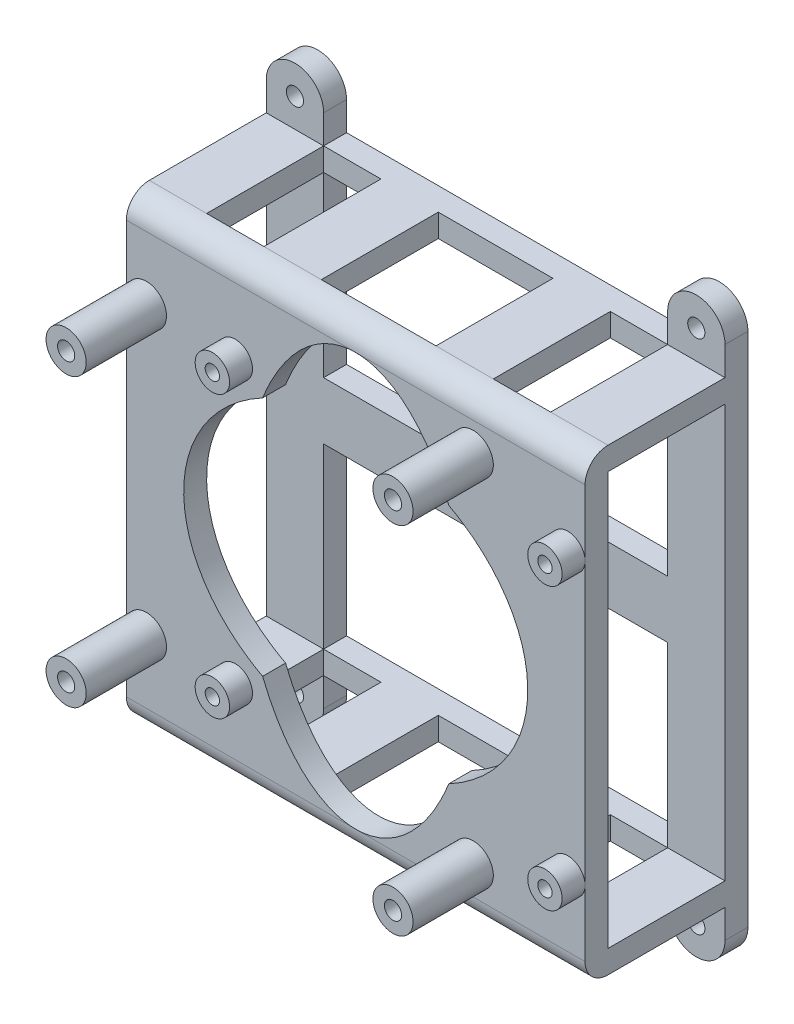
from build123d import *
from build123d.topology import SkipClean

# Parameters (mm, degrees)
CROQUIS1_W                 = 10
CROQUIS1_H                 = 10
CROQUIS1_R                 = 1.5
CROQUIS1_H_2               = 4
CROQUIS1_R_2               = 3
CROQUIS1_R_3               = 1.25
CROQUIS1_R_4               = 3.5
CROQUIS1_R_5               = 2.2
SALIENTE_EXTRUIR5_DEPTH    = 4
SALIENTE_EXTRUIR6_START    = 4
CROQUIS1_6_W               = 10
CROQUIS1_6_H               = 4
SALIENTE_EXTRUIR6_DEPTH    = 20.4
SALIENTE_EXTRUIR7_START    = 24.4
CROQUIS1_7_W               = 10
CROQUIS1_7_H               = 4
CROQUIS1_7_R               = 3
CROQUIS1_7_R_2             = 3.5
CROQUIS1_7_R_3             = 2.2
CROQUIS1_7_R_4             = 1.5
CROQUIS1_7_R_5             = 1.25
CROQUIS1_7_H_2             = 31
CROQUIS1_7_H_3             = 10
SALIENTE_EXTRUIR7_DEPTH    = 4
SALIENTE_EXTRUIR9_START    = 28.4
CROQUIS1_10_R              = 3
SALIENTE_EXTRUIR9_DEPTH    = 4
SALIENTE_EXTRUIR10_START   = 28.4
CROQUIS1_11_R              = 3.5
SALIENTE_EXTRUIR10_DEPTH   = 14
CORTAR_EXTRUIR1_DEPTH      = 14
CORTAR_EXTRUIR1_DEPTH_BACK = 14
CORTAR_EXTRUIR1_START      = 28.4
CROQUIS1_12_R              = 1.5
CROQUIS1_12_R_2            = 1.25
CORTAR_EXTRUIR2_START      = 24.4
CROQUIS1_13_R              = 2.2
CORTAR_EXTRUIR2_DEPTH      = 15
REDONDEO2_RADIUS           = 5
REDONDEO2_LENGTH           = 4
REDONDEO3_RADIUS           = 5
REDONDEO3_LENGTH           = 4
REDONDEO4_RADIUS           = 5
REDONDEO4_LENGTH           = 4
REDONDEO5_RADIUS           = 5
REDONDEO5_LENGTH           = 4
REDONDEO6_R                = 4
REDONDEO7_R                = 4
CORTAR_EXTRUIR6_START      = 28.4
CROQUIS2_RX                = 30
CROQUIS2_RY                = 25
CROQUIS2_RX_2              = 36
CROQUIS2_RY_2              = 20
CORTAR_EXTRUIR6_DEPTH      = 8


with BuildPart() as part:
    # Croquis1 → Saliente-Extruir5 (new body)
    # profile 1 of 42: a face of its own
    with SkipClean():  # the faces are left unmerged after this step: merging them gives an invalid solid
        with BuildSketch(Plane.XY):
            with Locations((-45.946521078, 63.070175439)):
                Rectangle(CROQUIS1_W, CROQUIS1_H)
            with Locations((-45.946521078, 63.070175439)):
                Circle(CROQUIS1_R, mode=Mode.SUBTRACT)
        # profile 2 of 42: a face of its own
        with BuildSketch(Plane.XY):
            with Locations((24.053478922, 63.070175439)):
                Rectangle(CROQUIS1_W, CROQUIS1_H)
            with Locations((24.053478922, 63.070175439)):
                Circle(CROQUIS1_R, mode=Mode.SUBTRACT)
        # profile 3 of 42: a face of its own
        with BuildSketch(Plane.XY):
            with Locations((24.053478922, -26.929824561)):
                Rectangle(CROQUIS1_W, CROQUIS1_H)
            with Locations((24.053478922, -26.929824561)):
                Circle(CROQUIS1_R, mode=Mode.SUBTRACT)
        # profile 4 of 42: a face of its own
        with BuildSketch(Plane.XY):
            with Locations((-45.946521078, -26.929824561)):
                Rectangle(CROQUIS1_W, CROQUIS1_H)
            with Locations((-45.946521078, -26.929824561)):
                Circle(CROQUIS1_R, mode=Mode.SUBTRACT)
        # profile 5 of 42: a face of its own
        with BuildSketch(Plane.XY):
            with Locations((-45.946521078, -19.929824561)):
                Rectangle(CROQUIS1_W, CROQUIS1_H_2)
        # profile 6 of 42: a face of its own
        with BuildSketch(Plane.XY):
            with Locations((-35.946521078, -19.929824561)):
                Rectangle(CROQUIS1_W, CROQUIS1_H_2)
        # profile 7 of 42: a face of its own
        with BuildSketch(Plane.XY):
            with Locations((-25.946521078, -19.929824561)):
                Rectangle(CROQUIS1_W, CROQUIS1_H_2)
        # profile 8 of 42: a face of its own
        with BuildSketch(Plane.XY):
            with Locations((-15.946521078, -19.929824561)):
                Rectangle(CROQUIS1_W, CROQUIS1_H_2)
        # profile 9 of 42: a face of its own
        with BuildSketch(Plane.XY):
            with Locations((-5.946521078, -19.929824561)):
                Rectangle(CROQUIS1_W, CROQUIS1_H_2)
        # profile 10 of 42: a face of its own
        with BuildSketch(Plane.XY):
            with Locations((4.053478922, -19.929824561)):
                Rectangle(CROQUIS1_W, CROQUIS1_H_2)
        # profile 11 of 42: a face of its own
        with BuildSketch(Plane.XY):
            with Locations((14.053478922, -19.929824561)):
                Rectangle(CROQUIS1_W, CROQUIS1_H_2)
        # profile 12 of 42: a face of its own
        with BuildSketch(Plane.XY):
            with Locations((24.053478922, -19.929824561)):
                Rectangle(CROQUIS1_W, CROQUIS1_H_2)
        # profile 13 of 42: a face of its own
        with BuildSketch(Plane.XY):
            Polygon((29.053478922, 13.070175439), (19.053478922, 13.070175439), (19.053478922, -17.929824561), (29.053478922, -17.929824561), (29.053478922, -6.429824561), align=None)
            with Locations((26.053478922, -6.429824561)):
                Circle(CROQUIS1_R_2, mode=Mode.SUBTRACT)
        # profile 14 of 42: a face of its own
        with BuildSketch(Plane.XY):
            with Locations((26.053478922, -6.429824561)):
                Circle(CROQUIS1_R_2)
            with Locations((26.053478922, -6.429824561)):
                Circle(CROQUIS1_R_3, mode=Mode.SUBTRACT)
        # profile 15 of 42: a face of its own
        with BuildSketch(Plane.XY):
            with Locations((26.053478922, -6.429824561)):
                Circle(CROQUIS1_R_3)
        # profile 16 of 42: a face of its own
        with BuildSketch(Plane.XY):
            Polygon((-40.946521078, -17.929824561), (-40.946521078, 13.070175439), (-50.946521078, 13.070175439), (-50.946521078, -6.929824541), (-50.946521078, -17.929824561), align=None)
            with BuildLine():
                ThreePointArc((-43.946521078, -6.929824561), (-47.446521088, -10.429824561), (-50.946521078, -6.929824541))
                ThreePointArc((-50.946521078, -6.929824541), (-47.446521067, -3.429824561), (-43.946521078, -6.929824561))
            make_face(mode=Mode.SUBTRACT)
        # profile 17 of 42: a face of its own
        with BuildSketch(Plane.XY):
            with Locations((-47.446521078, -6.929824561)):
                Circle(CROQUIS1_R_4)
            with Locations((-47.446521078, -6.929824561)):
                Circle(CROQUIS1_R_5, mode=Mode.SUBTRACT)
        # profile 18 of 42: a face of its own
        with BuildSketch(Plane.XY):
            with Locations((-47.446521078, -6.929824561)):
                Circle(CROQUIS1_R_5)
            with Locations((-47.446521078, -6.929824561)):
                Circle(CROQUIS1_R, mode=Mode.SUBTRACT)
        # profile 19 of 42: a face of its own
        with BuildSketch(Plane.XY):
            with Locations((-47.446521078, -6.929824561)):
                Circle(CROQUIS1_R)
        # profile 20 of 42: a face of its own
        with BuildSketch(Plane.XY):
            with Locations((-45.946521078, 18.070175439)):
                Rectangle(CROQUIS1_W, CROQUIS1_H)
        # profile 21 of 42: a face of its own
        with BuildSketch(Plane.XY):
            with Locations((-35.946521078, 18.070175439)):
                Rectangle(CROQUIS1_W, CROQUIS1_H)
        # profile 22 of 42: a face of its own
        with BuildSketch(Plane.XY):
            with Locations((-25.946521078, 18.070175439)):
                Rectangle(CROQUIS1_W, CROQUIS1_H)
        # profile 23 of 42: a face of its own
        with BuildSketch(Plane.XY):
            with Locations((-15.946521078, 18.070175439)):
                Rectangle(CROQUIS1_W, CROQUIS1_H)
        # profile 24 of 42: a face of its own
        with BuildSketch(Plane.XY):
            with Locations((-5.946521078, 18.070175439)):
                Rectangle(CROQUIS1_W, CROQUIS1_H)
        # profile 25 of 42: a face of its own
        with BuildSketch(Plane.XY):
            with Locations((4.053478922, 18.070175439)):
                Rectangle(CROQUIS1_W, CROQUIS1_H)
        # profile 26 of 42: a face of its own
        with BuildSketch(Plane.XY):
            with Locations((14.053478922, 18.070175439)):
                Rectangle(CROQUIS1_W, CROQUIS1_H)
        # profile 27 of 42: a face of its own
        with BuildSketch(Plane.XY):
            with Locations((24.053478922, 18.070175439)):
                Rectangle(CROQUIS1_W, CROQUIS1_H)
        # profile 28 of 42: a face of its own
        with BuildSketch(Plane.XY):
            Polygon((-40.946521078, 54.070175439), (-50.946521078, 54.070175439), (-50.946521078, 43.070175439), (-50.946521078, 23.070175439), (-40.946521078, 23.070175439), align=None)
            with BuildLine():
                ThreePointArc((-43.946521078, 43.070175439), (-47.446521078, 39.570175439), (-50.946521078, 43.070175439))
                ThreePointArc((-50.946521078, 43.070175439), (-47.446521078, 46.570175439), (-43.946521078, 43.070175439))
            make_face(mode=Mode.SUBTRACT)
        # profile 29 of 42: a face of its own
        with BuildSketch(Plane.XY):
            with Locations((-45.946521078, 56.070175439)):
                Rectangle(CROQUIS1_W, CROQUIS1_H_2)
        # profile 30 of 42: a face of its own
        with BuildSketch(Plane.XY):
            with Locations((-47.446521078, 43.070175439)):
                Circle(CROQUIS1_R_4)
            with Locations((-47.446521078, 43.070175439)):
                Circle(CROQUIS1_R_5, mode=Mode.SUBTRACT)
        # profile 31 of 42: a face of its own
        with BuildSketch(Plane.XY):
            with Locations((-47.446521078, 43.070175439)):
                Circle(CROQUIS1_R_5)
            with Locations((-47.446521078, 43.070175439)):
                Circle(CROQUIS1_R, mode=Mode.SUBTRACT)
        # profile 32 of 42: a face of its own
        with BuildSketch(Plane.XY):
            with Locations((-47.446521078, 43.070175439)):
                Circle(CROQUIS1_R)
        # profile 33 of 42: a face of its own
        with BuildSketch(Plane.XY):
            with Locations((-35.946521078, 56.070175439)):
                Rectangle(CROQUIS1_W, CROQUIS1_H_2)
        # profile 34 of 42: a face of its own
        with BuildSketch(Plane.XY):
            with Locations((-25.946521078, 56.070175439)):
                Rectangle(CROQUIS1_W, CROQUIS1_H_2)
        # profile 35 of 42: a face of its own
        with BuildSketch(Plane.XY):
            with Locations((-15.946521078, 56.070175439)):
                Rectangle(CROQUIS1_W, CROQUIS1_H_2)
        # profile 36 of 42: a face of its own
        with BuildSketch(Plane.XY):
            with Locations((-5.946521078, 56.070175439)):
                Rectangle(CROQUIS1_W, CROQUIS1_H_2)
        # profile 37 of 42: a face of its own
        with BuildSketch(Plane.XY):
            with Locations((4.053478922, 56.070175439)):
                Rectangle(CROQUIS1_W, CROQUIS1_H_2)
        # profile 38 of 42: a face of its own
        with BuildSketch(Plane.XY):
            with Locations((14.053478922, 56.070175439)):
                Rectangle(CROQUIS1_W, CROQUIS1_H_2)
        # profile 39 of 42: a face of its own
        with BuildSketch(Plane.XY):
            with Locations((24.053478922, 56.070175439)):
                Rectangle(CROQUIS1_W, CROQUIS1_H_2)
        # profile 40 of 42: a face of its own
        with BuildSketch(Plane.XY):
            Polygon((29.053478922, 54.070175439), (19.053478922, 54.070175439), (19.053478922, 23.070175439), (29.053478922, 23.070175439), (29.053478922, 42.570175439), align=None)
            with Locations((26.053478922, 42.570175439)):
                Circle(CROQUIS1_R_2, mode=Mode.SUBTRACT)
        # profile 41 of 42: a face of its own
        with BuildSketch(Plane.XY):
            with Locations((26.053478922, 42.570175439)):
                Circle(CROQUIS1_R_2)
            with Locations((26.053478922, 42.570175439)):
                Circle(CROQUIS1_R_3, mode=Mode.SUBTRACT)
        # profile 42 of 42: a face of its own
        with BuildSketch(Plane.XY):
            with Locations((26.053478922, 42.570175439)):
                Circle(CROQUIS1_R_3)
        extrude(amount=SALIENTE_EXTRUIR5_DEPTH)

    # Croquis1<6> → Saliente-Extruir6 (add)
    with BuildSketch(Plane.XY.offset(SALIENTE_EXTRUIR6_START)):
        with Locations((-45.946521078, 56.070175439)):
            Rectangle(CROQUIS1_6_W, CROQUIS1_6_H)
        with Locations((-25.946521078, 56.070175439)):
            Rectangle(CROQUIS1_6_W, CROQUIS1_6_H)
        with Locations((24.053478922, 56.070175439)):
            Rectangle(CROQUIS1_6_W, CROQUIS1_6_H)
        with Locations((4.053478922, 56.070175439)):
            Rectangle(CROQUIS1_6_W, CROQUIS1_6_H)
        with Locations((-45.946521078, -19.929824561)):
            Rectangle(CROQUIS1_6_W, CROQUIS1_6_H)
        with Locations((-25.946521078, -19.929824561)):
            Rectangle(CROQUIS1_6_W, CROQUIS1_6_H)
        with Locations((4.053478922, -19.929824561)):
            Rectangle(CROQUIS1_6_W, CROQUIS1_6_H)
        with Locations((24.053478922, -19.929824561)):
            Rectangle(CROQUIS1_6_W, CROQUIS1_6_H)
    extrude(amount=SALIENTE_EXTRUIR6_DEPTH)

    # Croquis1<7> → Saliente-Extruir7 (add)
    # profile 1 of 90: a face of its own
    with SkipClean():  # the faces are left unmerged after this step: merging them gives an invalid solid
        with BuildSketch(Plane.XY.offset(SALIENTE_EXTRUIR7_START)):
            with Locations((-45.946521078, 56.070175439)):
                Rectangle(CROQUIS1_7_W, CROQUIS1_7_H)
        # profile 2 of 90: a face of its own
        with BuildSketch(Plane.XY.offset(SALIENTE_EXTRUIR7_START)):
            with Locations((-35.946521078, 56.070175439)):
                Rectangle(CROQUIS1_7_W, CROQUIS1_7_H)
        # profile 3 of 90: a face of its own
        with BuildSketch(Plane.XY.offset(SALIENTE_EXTRUIR7_START)):
            with Locations((-15.946521078, 56.070175439)):
                Rectangle(CROQUIS1_7_W, CROQUIS1_7_H)
        # profile 4 of 90: a face of its own
        with BuildSketch(Plane.XY.offset(SALIENTE_EXTRUIR7_START)):
            with Locations((-5.946521078, 56.070175439)):
                Rectangle(CROQUIS1_7_W, CROQUIS1_7_H)
        # profile 5 of 90: a face of its own
        with BuildSketch(Plane.XY.offset(SALIENTE_EXTRUIR7_START)):
            with Locations((4.053478922, 56.070175439)):
                Rectangle(CROQUIS1_7_W, CROQUIS1_7_H)
        # profile 6 of 90: a face of its own
        with BuildSketch(Plane.XY.offset(SALIENTE_EXTRUIR7_START)):
            with Locations((-25.946521078, 56.070175439)):
                Rectangle(CROQUIS1_7_W, CROQUIS1_7_H)
        # profile 7 of 90: a face of its own
        with BuildSketch(Plane.XY.offset(SALIENTE_EXTRUIR7_START)):
            with Locations((14.053478922, 56.070175439)):
                Rectangle(CROQUIS1_7_W, CROQUIS1_7_H)
        # profile 8 of 90: a face of its own
        with BuildSketch(Plane.XY.offset(SALIENTE_EXTRUIR7_START)):
            Polygon((29.053478922, 54.070175439), (19.053478922, 54.070175439), (19.053478922, 23.070175439), (29.053478922, 23.070175439), (29.053478922, 42.570175439), align=None)
            with Locations((26.053478922, 42.570175439)):
                Circle(CROQUIS1_7_R, mode=Mode.SUBTRACT)
        # profile 9 of 90: a face of its own
        with BuildSketch(Plane.XY.offset(SALIENTE_EXTRUIR7_START)):
            Polygon((-40.946521078, 54.070175439), (-50.946521078, 54.070175439), (-50.946521078, 43.070175439), (-50.946521078, 23.070175439), (-40.946521078, 23.070175439), align=None)
            with BuildLine():
                ThreePointArc((-43.946521078, 43.070175439), (-47.446521078, 39.570175439), (-50.946521078, 43.070175439))
                ThreePointArc((-50.946521078, 43.070175439), (-47.446521078, 46.570175439), (-43.946521078, 43.070175439))
            make_face(mode=Mode.SUBTRACT)
        # profile 10 of 90: a face of its own
        with BuildSketch(Plane.XY.offset(SALIENTE_EXTRUIR7_START)):
            with BuildLine():
                Line((-30.946521078, 54.070175439), (-40.946521078, 54.070175439))
                Line((-40.946521078, 54.070175439), (-40.946521078, 23.070175439))
                Line((-40.946521078, 23.070175439), (-30.946521078, 23.070175439))
                Line((-30.946521078, 23.070175439), (-30.946521078, 39.741748314))
                ThreePointArc((-30.946521078, 39.741748314), (-34.946521078, 42.570175439), (-30.946521078, 45.398602563))
                Line((-30.946521078, 45.398602563), (-30.946521078, 54.070175439))
            make_face()
        # profile 11 of 90: a face of its own
        with BuildSketch(Plane.XY.offset(SALIENTE_EXTRUIR7_START)):
            with Locations((-47.446521078, 43.070175439)):
                Circle(CROQUIS1_7_R_2)
            with Locations((-47.446521078, 43.070175439)):
                Circle(CROQUIS1_7_R_3, mode=Mode.SUBTRACT)
        # profile 12 of 90: a face of its own
        with BuildSketch(Plane.XY.offset(SALIENTE_EXTRUIR7_START)):
            with Locations((-47.446521078, 43.070175439)):
                Circle(CROQUIS1_7_R_3)
            with Locations((-47.446521078, 43.070175439)):
                Circle(CROQUIS1_7_R_4, mode=Mode.SUBTRACT)
        # profile 13 of 90: a face of its own
        with BuildSketch(Plane.XY.offset(SALIENTE_EXTRUIR7_START)):
            with Locations((-47.446521078, 43.070175439)):
                Circle(CROQUIS1_7_R_4)
        # profile 14 of 90: a face of its own
        with BuildSketch(Plane.XY.offset(SALIENTE_EXTRUIR7_START)):
            with Locations((26.053478922, 42.570175439)):
                Circle(CROQUIS1_7_R)
            with Locations((26.053478922, 42.570175439)):
                Circle(CROQUIS1_7_R_5, mode=Mode.SUBTRACT)
        # profile 15 of 90: a face of its own
        with BuildSketch(Plane.XY.offset(SALIENTE_EXTRUIR7_START)):
            with Locations((26.053478922, 42.570175439)):
                Circle(CROQUIS1_7_R_5)
        # profile 16 of 90: a face of its own
        with BuildSketch(Plane.XY.offset(SALIENTE_EXTRUIR7_START)):
            with Locations((24.053478922, 56.070175439)):
                Rectangle(CROQUIS1_7_W, CROQUIS1_7_H)
        # profile 17 of 90: a face of its own
        with BuildSketch(Plane.XY.offset(SALIENTE_EXTRUIR7_START)):
            with BuildLine():
                ThreePointArc((-28.946521078, 42.570175439), (-29.497031335, 44.302226246), (-30.946521078, 45.398602563))
                Line((-30.946521078, 45.398602563), (-30.946521078, 43.320175439))
                ThreePointArc((-30.946521078, 43.320175439), (-30.760666955, 42.965460146), (-30.696521078, 42.570175439))
                ThreePointArc((-30.696521078, 42.570175439), (-30.760666955, 42.174890731), (-30.946521078, 41.820175439))
                Line((-30.946521078, 41.820175439), (-30.946521078, 39.741748314))
                ThreePointArc((-30.946521078, 39.741748314), (-29.497031335, 40.838124631), (-28.946521078, 42.570175439))
            make_face()
        # profile 18 of 90: a face of its own
        with BuildSketch(Plane.XY.offset(SALIENTE_EXTRUIR7_START)):
            with BuildLine():
                Line((-30.946521078, 43.320175439), (-30.946521078, 45.398602563))
                ThreePointArc((-30.946521078, 45.398602563), (-34.946521078, 42.570175439), (-30.946521078, 39.741748314))
                Line((-30.946521078, 39.741748314), (-30.946521078, 41.820175439))
                ThreePointArc((-30.946521078, 41.820175439), (-33.196521078, 42.570175439), (-30.946521078, 43.320175439))
            make_face()
        # profile 19 of 90: a face of its own
        with BuildSketch(Plane.XY.offset(SALIENTE_EXTRUIR7_START)):
            with BuildLine():
                ThreePointArc((-30.696521078, 42.570175439), (-30.760666955, 42.965460146), (-30.946521078, 43.320175439))
                Line((-30.946521078, 43.320175439), (-30.946521078, 41.820175439))
                ThreePointArc((-30.946521078, 41.820175439), (-30.760666955, 42.174890731), (-30.696521078, 42.570175439))
            make_face()
        # profile 20 of 90: a face of its own
        with BuildSketch(Plane.XY.offset(SALIENTE_EXTRUIR7_START)):
            with BuildLine():
                Line((-30.946521078, 41.820175439), (-30.946521078, 43.320175439))
                ThreePointArc((-30.946521078, 43.320175439), (-33.196521078, 42.570175439), (-30.946521078, 41.820175439))
            make_face()
        # profile 21 of 90: a face of its own
        with BuildSketch(Plane.XY.offset(SALIENTE_EXTRUIR7_START)):
            with BuildLine():
                ThreePointArc((-28.946521078, 42.570175439), (-29.497031335, 44.302226246), (-30.946521078, 45.398602563))
                Line((-30.946521078, 45.398602563), (-30.946521078, 43.320175439))
                ThreePointArc((-30.946521078, 43.320175439), (-30.760666955, 42.965460146), (-30.696521078, 42.570175439))
                ThreePointArc((-30.696521078, 42.570175439), (-30.760666955, 42.174890731), (-30.946521078, 41.820175439))
                Line((-30.946521078, 41.820175439), (-30.946521078, 39.741748314))
                ThreePointArc((-30.946521078, 39.741748314), (-29.497031335, 40.838124631), (-28.946521078, 42.570175439))
            make_face()
        # profile 22 of 90: a face of its own
        with BuildSketch(Plane.XY.offset(SALIENTE_EXTRUIR7_START)):
            with BuildLine():
                Line((-30.946521078, 43.320175439), (-30.946521078, 45.398602563))
                ThreePointArc((-30.946521078, 45.398602563), (-34.946521078, 42.570175439), (-30.946521078, 39.741748314))
                Line((-30.946521078, 39.741748314), (-30.946521078, 41.820175439))
                ThreePointArc((-30.946521078, 41.820175439), (-33.196521078, 42.570175439), (-30.946521078, 43.320175439))
            make_face()
        # profile 23 of 90: a face of its own
        with BuildSketch(Plane.XY.offset(SALIENTE_EXTRUIR7_START)):
            with BuildLine():
                ThreePointArc((-30.696521078, 42.570175439), (-30.760666955, 42.965460146), (-30.946521078, 43.320175439))
                Line((-30.946521078, 43.320175439), (-30.946521078, 41.820175439))
                ThreePointArc((-30.946521078, 41.820175439), (-30.760666955, 42.174890731), (-30.696521078, 42.570175439))
            make_face()
        # profile 24 of 90: a face of its own
        with BuildSketch(Plane.XY.offset(SALIENTE_EXTRUIR7_START)):
            with BuildLine():
                Line((-30.946521078, 41.820175439), (-30.946521078, 43.320175439))
                ThreePointArc((-30.946521078, 43.320175439), (-33.196521078, 42.570175439), (-30.946521078, 41.820175439))
            make_face()
        # profile 25 of 90: a face of its own
        with BuildSketch(Plane.XY.offset(SALIENTE_EXTRUIR7_START)):
            with BuildLine():
                Line((-20.946521078, 54.070175439), (-30.946521078, 54.070175439))
                Line((-30.946521078, 54.070175439), (-30.946521078, 45.398602563))
                ThreePointArc((-30.946521078, 45.398602563), (-29.497031335, 44.302226246), (-28.946521078, 42.570175439))
                ThreePointArc((-28.946521078, 42.570175439), (-29.497031335, 40.838124631), (-30.946521078, 39.741748314))
                Line((-30.946521078, 39.741748314), (-30.946521078, 23.070175439))
                Line((-30.946521078, 23.070175439), (-20.946521078, 23.070175439))
                Line((-20.946521078, 23.070175439), (-20.946521078, 54.070175439))
            make_face()
        # profile 26 of 90: a face of its own
        with BuildSketch(Plane.XY.offset(SALIENTE_EXTRUIR7_START)):
            with Locations((-15.946521078, 38.570175439)):
                Rectangle(CROQUIS1_7_W, CROQUIS1_7_H_2)
        # profile 27 of 90: a face of its own
        with BuildSketch(Plane.XY.offset(SALIENTE_EXTRUIR7_START)):
            with Locations((-5.946521078, 38.570175439)):
                Rectangle(CROQUIS1_7_W, CROQUIS1_7_H_2)
        # profile 28 of 90: a face of its own
        with BuildSketch(Plane.XY.offset(SALIENTE_EXTRUIR7_START)):
            with BuildLine():
                Line((9.053478922, 54.070175439), (-0.946521078, 54.070175439))
                Line((-0.946521078, 54.070175439), (-0.946521078, 23.070175439))
                Line((-0.946521078, 23.070175439), (9.053478922, 23.070175439))
                Line((9.053478922, 23.070175439), (9.053478922, 45.606073823))
                ThreePointArc((9.053478922, 45.606073823), (6.053478922, 49.070175439), (9.053478922, 52.534277054))
                Line((9.053478922, 52.534277054), (9.053478922, 54.070175439))
            make_face()
        # profile 29 of 90: a face of its own
        with BuildSketch(Plane.XY.offset(SALIENTE_EXTRUIR7_START)):
            with BuildLine():
                ThreePointArc((13.053478922, 49.070175439), (11.84476677, 51.71592675), (9.053478922, 52.534277054))
                Line((9.053478922, 52.534277054), (9.053478922, 51.212603967))
                ThreePointArc((9.053478922, 51.212603967), (10.920958355, 50.793544233), (11.753478922, 49.070175439))
                ThreePointArc((11.753478922, 49.070175439), (10.920958355, 47.346806645), (9.053478922, 46.92774691))
                Line((9.053478922, 46.92774691), (9.053478922, 45.606073823))
                ThreePointArc((9.053478922, 45.606073823), (11.84476677, 46.424424128), (13.053478922, 49.070175439))
            make_face()
        # profile 30 of 90: a face of its own
        with BuildSketch(Plane.XY.offset(SALIENTE_EXTRUIR7_START)):
            with BuildLine():
                Line((9.053478922, 51.212603967), (9.053478922, 52.534277054))
                ThreePointArc((9.053478922, 52.534277054), (6.053478922, 49.070175439), (9.053478922, 45.606073823))
                Line((9.053478922, 45.606073823), (9.053478922, 46.92774691))
                ThreePointArc((9.053478922, 46.92774691), (7.353478922, 49.070175439), (9.053478922, 51.212603967))
            make_face()
        # profile 31 of 90: a face of its own
        with BuildSketch(Plane.XY.offset(SALIENTE_EXTRUIR7_START)):
            with BuildLine():
                ThreePointArc((11.753478922, 49.070175439), (10.920958355, 50.793544233), (9.053478922, 51.212603967))
                Line((9.053478922, 51.212603967), (9.053478922, 50.484389001))
                ThreePointArc((9.053478922, 50.484389001), (10.419504326, 50.29492031), (11.053478922, 49.070175439))
                ThreePointArc((11.053478922, 49.070175439), (10.419504326, 47.845430567), (9.053478922, 47.655961876))
                Line((9.053478922, 47.655961876), (9.053478922, 46.92774691))
                ThreePointArc((9.053478922, 46.92774691), (10.920958355, 47.346806645), (11.753478922, 49.070175439))
            make_face()
        # profile 32 of 90: a face of its own
        with BuildSketch(Plane.XY.offset(SALIENTE_EXTRUIR7_START)):
            with BuildLine():
                Line((9.053478922, 50.484389001), (9.053478922, 51.212603967))
                ThreePointArc((9.053478922, 51.212603967), (7.353478922, 49.070175439), (9.053478922, 46.92774691))
                Line((9.053478922, 46.92774691), (9.053478922, 47.655961876))
                ThreePointArc((9.053478922, 47.655961876), (8.053478922, 49.070175439), (9.053478922, 50.484389001))
            make_face()
        # profile 33 of 90: a face of its own
        with BuildSketch(Plane.XY.offset(SALIENTE_EXTRUIR7_START)):
            with BuildLine():
                ThreePointArc((11.053478922, 49.070175439), (10.419504326, 50.29492031), (9.053478922, 50.484389001))
                Line((9.053478922, 50.484389001), (9.053478922, 47.655961876))
                ThreePointArc((9.053478922, 47.655961876), (10.419504326, 47.845430567), (11.053478922, 49.070175439))
            make_face()
        # profile 34 of 90: a face of its own
        with BuildSketch(Plane.XY.offset(SALIENTE_EXTRUIR7_START)):
            with BuildLine():
                Line((9.053478922, 47.655961876), (9.053478922, 50.484389001))
                ThreePointArc((9.053478922, 50.484389001), (8.053478922, 49.070175439), (9.053478922, 47.655961876))
            make_face()
        # profile 35 of 90: a face of its own
        with BuildSketch(Plane.XY.offset(SALIENTE_EXTRUIR7_START)):
            with BuildLine():
                ThreePointArc((11.053478922, 49.070175439), (10.419504326, 50.29492031), (9.053478922, 50.484389001))
                Line((9.053478922, 50.484389001), (9.053478922, 47.655961876))
                ThreePointArc((9.053478922, 47.655961876), (10.419504326, 47.845430567), (11.053478922, 49.070175439))
            make_face()
        # profile 36 of 90: a face of its own
        with BuildSketch(Plane.XY.offset(SALIENTE_EXTRUIR7_START)):
            with BuildLine():
                Line((9.053478922, 47.655961876), (9.053478922, 50.484389001))
                ThreePointArc((9.053478922, 50.484389001), (8.053478922, 49.070175439), (9.053478922, 47.655961876))
            make_face()
        # profile 37 of 90: a face of its own
        with BuildSketch(Plane.XY.offset(SALIENTE_EXTRUIR7_START)):
            with BuildLine():
                ThreePointArc((11.753478922, 49.070175439), (10.920958355, 50.793544233), (9.053478922, 51.212603967))
                Line((9.053478922, 51.212603967), (9.053478922, 50.484389001))
                ThreePointArc((9.053478922, 50.484389001), (10.419504326, 50.29492031), (11.053478922, 49.070175439))
                ThreePointArc((11.053478922, 49.070175439), (10.419504326, 47.845430567), (9.053478922, 47.655961876))
                Line((9.053478922, 47.655961876), (9.053478922, 46.92774691))
                ThreePointArc((9.053478922, 46.92774691), (10.920958355, 47.346806645), (11.753478922, 49.070175439))
            make_face()
        # profile 38 of 90: a face of its own
        with BuildSketch(Plane.XY.offset(SALIENTE_EXTRUIR7_START)):
            with BuildLine():
                Line((9.053478922, 50.484389001), (9.053478922, 51.212603967))
                ThreePointArc((9.053478922, 51.212603967), (7.353478922, 49.070175439), (9.053478922, 46.92774691))
                Line((9.053478922, 46.92774691), (9.053478922, 47.655961876))
                ThreePointArc((9.053478922, 47.655961876), (8.053478922, 49.070175439), (9.053478922, 50.484389001))
            make_face()
        # profile 39 of 90: a face of its own
        with BuildSketch(Plane.XY.offset(SALIENTE_EXTRUIR7_START)):
            with BuildLine():
                ThreePointArc((13.053478922, 49.070175439), (11.84476677, 51.71592675), (9.053478922, 52.534277054))
                Line((9.053478922, 52.534277054), (9.053478922, 51.212603967))
                ThreePointArc((9.053478922, 51.212603967), (10.920958355, 50.793544233), (11.753478922, 49.070175439))
                ThreePointArc((11.753478922, 49.070175439), (10.920958355, 47.346806645), (9.053478922, 46.92774691))
                Line((9.053478922, 46.92774691), (9.053478922, 45.606073823))
                ThreePointArc((9.053478922, 45.606073823), (11.84476677, 46.424424128), (13.053478922, 49.070175439))
            make_face()
        # profile 40 of 90: a face of its own
        with BuildSketch(Plane.XY.offset(SALIENTE_EXTRUIR7_START)):
            with BuildLine():
                Line((9.053478922, 51.212603967), (9.053478922, 52.534277054))
                ThreePointArc((9.053478922, 52.534277054), (6.053478922, 49.070175439), (9.053478922, 45.606073823))
                Line((9.053478922, 45.606073823), (9.053478922, 46.92774691))
                ThreePointArc((9.053478922, 46.92774691), (7.353478922, 49.070175439), (9.053478922, 51.212603967))
            make_face()
        # profile 41 of 90: a face of its own
        with BuildSketch(Plane.XY.offset(SALIENTE_EXTRUIR7_START)):
            with BuildLine():
                Line((19.053478922, 54.070175439), (9.053478922, 54.070175439))
                Line((9.053478922, 54.070175439), (9.053478922, 52.534277054))
                ThreePointArc((9.053478922, 52.534277054), (11.84476677, 51.71592675), (13.053478922, 49.070175439))
                ThreePointArc((13.053478922, 49.070175439), (11.84476677, 46.424424128), (9.053478922, 45.606073823))
                Line((9.053478922, 45.606073823), (9.053478922, 23.070175439))
                Line((9.053478922, 23.070175439), (19.053478922, 23.070175439))
                Line((19.053478922, 23.070175439), (19.053478922, 54.070175439))
            make_face()
        # profile 42 of 90: a face of its own
        with BuildSketch(Plane.XY.offset(SALIENTE_EXTRUIR7_START)):
            with Locations((24.053478922, 18.070175439)):
                Rectangle(CROQUIS1_7_W, CROQUIS1_7_H_3)
        # profile 43 of 90: a face of its own
        with BuildSketch(Plane.XY.offset(SALIENTE_EXTRUIR7_START)):
            with Locations((14.053478922, 18.070175439)):
                Rectangle(CROQUIS1_7_W, CROQUIS1_7_H_3)
        # profile 44 of 90: a face of its own
        with BuildSketch(Plane.XY.offset(SALIENTE_EXTRUIR7_START)):
            with Locations((4.053478922, 18.070175439)):
                Rectangle(CROQUIS1_7_W, CROQUIS1_7_H_3)
        # profile 45 of 90: a face of its own
        with BuildSketch(Plane.XY.offset(SALIENTE_EXTRUIR7_START)):
            with Locations((-5.946521078, 18.070175439)):
                Rectangle(CROQUIS1_7_W, CROQUIS1_7_H_3)
        # profile 46 of 90: a face of its own
        with BuildSketch(Plane.XY.offset(SALIENTE_EXTRUIR7_START)):
            with Locations((-15.946521078, 18.070175439)):
                Rectangle(CROQUIS1_7_W, CROQUIS1_7_H_3)
        # profile 47 of 90: a face of its own
        with BuildSketch(Plane.XY.offset(SALIENTE_EXTRUIR7_START)):
            with Locations((-25.946521078, 18.070175439)):
                Rectangle(CROQUIS1_7_W, CROQUIS1_7_H_3)
        # profile 48 of 90: a face of its own
        with BuildSketch(Plane.XY.offset(SALIENTE_EXTRUIR7_START)):
            with Locations((-35.946521078, 18.070175439)):
                Rectangle(CROQUIS1_7_W, CROQUIS1_7_H_3)
        # profile 49 of 90: a face of its own
        with BuildSketch(Plane.XY.offset(SALIENTE_EXTRUIR7_START)):
            with Locations((-45.946521078, 18.070175439)):
                Rectangle(CROQUIS1_7_W, CROQUIS1_7_H_3)
        # profile 50 of 90: a face of its own
        with BuildSketch(Plane.XY.offset(SALIENTE_EXTRUIR7_START)):
            with BuildLine():
                Line((-30.946521078, 13.070175439), (-40.946521078, 13.070175439))
                Line((-40.946521078, 13.070175439), (-40.946521078, -17.929824561))
                Line((-40.946521078, -17.929824561), (-30.946521078, -17.929824561))
                Line((-30.946521078, -17.929824561), (-30.946521078, -9.258251686))
                ThreePointArc((-30.946521078, -9.258251686), (-34.946521078, -6.429824561), (-30.946521078, -3.601397437))
                Line((-30.946521078, -3.601397437), (-30.946521078, 13.070175439))
            make_face()
        # profile 51 of 90: a face of its own
        with BuildSketch(Plane.XY.offset(SALIENTE_EXTRUIR7_START)):
            with BuildLine():
                Line((-20.946521078, 13.070175439), (-30.946521078, 13.070175439))
                Line((-30.946521078, 13.070175439), (-30.946521078, -3.601397437))
                ThreePointArc((-30.946521078, -3.601397437), (-29.497031335, -4.697773754), (-28.946521078, -6.429824561))
                ThreePointArc((-28.946521078, -6.429824561), (-29.497031335, -8.161875369), (-30.946521078, -9.258251686))
                Line((-30.946521078, -9.258251686), (-30.946521078, -17.929824561))
                Line((-30.946521078, -17.929824561), (-20.946521078, -17.929824561))
                Line((-20.946521078, -17.929824561), (-20.946521078, 13.070175439))
            make_face()
        # profile 52 of 90: a face of its own
        with BuildSketch(Plane.XY.offset(SALIENTE_EXTRUIR7_START)):
            with Locations((-15.946521078, -2.429824561)):
                Rectangle(CROQUIS1_7_W, CROQUIS1_7_H_2)
        # profile 53 of 90: a face of its own
        with BuildSketch(Plane.XY.offset(SALIENTE_EXTRUIR7_START)):
            with Locations((-5.946521078, -2.429824561)):
                Rectangle(CROQUIS1_7_W, CROQUIS1_7_H_2)
        # profile 54 of 90: a face of its own
        with BuildSketch(Plane.XY.offset(SALIENTE_EXTRUIR7_START)):
            with BuildLine():
                Line((9.053478922, 13.070175439), (-0.946521078, 13.070175439))
                Line((-0.946521078, 13.070175439), (-0.946521078, -17.929824561))
                Line((-0.946521078, -17.929824561), (9.053478922, -17.929824561))
                Line((9.053478922, -17.929824561), (9.053478922, -16.393926177))
                ThreePointArc((9.053478922, -16.393926177), (6.053478922, -12.929824561), (9.053478922, -9.465722946))
                Line((9.053478922, -9.465722946), (9.053478922, 13.070175439))
            make_face()
        # profile 55 of 90: a face of its own
        with BuildSketch(Plane.XY.offset(SALIENTE_EXTRUIR7_START)):
            with BuildLine():
                Line((19.053478922, 13.070175439), (9.053478922, 13.070175439))
                Line((9.053478922, 13.070175439), (9.053478922, -9.465722946))
                ThreePointArc((9.053478922, -9.465722946), (11.84476677, -10.28407325), (13.053478922, -12.929824561))
                ThreePointArc((13.053478922, -12.929824561), (11.84476677, -15.575575872), (9.053478922, -16.393926177))
                Line((9.053478922, -16.393926177), (9.053478922, -17.929824561))
                Line((9.053478922, -17.929824561), (19.053478922, -17.929824561))
                Line((19.053478922, -17.929824561), (19.053478922, 13.070175439))
            make_face()
        # profile 56 of 90: a face of its own
        with BuildSketch(Plane.XY.offset(SALIENTE_EXTRUIR7_START)):
            Polygon((-40.946521078, -17.929824561), (-40.946521078, 13.070175439), (-50.946521078, 13.070175439), (-50.946521078, -6.929824541), (-50.946521078, -17.929824561), align=None)
            with BuildLine():
                ThreePointArc((-43.946521078, -6.929824561), (-47.446521088, -10.429824561), (-50.946521078, -6.929824541))
                ThreePointArc((-50.946521078, -6.929824541), (-47.446521067, -3.429824561), (-43.946521078, -6.929824561))
            make_face(mode=Mode.SUBTRACT)
        # profile 57 of 90: a face of its own
        with BuildSketch(Plane.XY.offset(SALIENTE_EXTRUIR7_START)):
            with Locations((-47.446521078, -6.929824561)):
                Circle(CROQUIS1_7_R_2)
            with Locations((-47.446521078, -6.929824561)):
                Circle(CROQUIS1_7_R_3, mode=Mode.SUBTRACT)
        # profile 58 of 90: a face of its own
        with BuildSketch(Plane.XY.offset(SALIENTE_EXTRUIR7_START)):
            with Locations((-47.446521078, -6.929824561)):
                Circle(CROQUIS1_7_R_3)
            with Locations((-47.446521078, -6.929824561)):
                Circle(CROQUIS1_7_R_4, mode=Mode.SUBTRACT)
        # profile 59 of 90: a face of its own
        with BuildSketch(Plane.XY.offset(SALIENTE_EXTRUIR7_START)):
            with Locations((-47.446521078, -6.929824561)):
                Circle(CROQUIS1_7_R_4)
        # profile 60 of 90: a face of its own
        with BuildSketch(Plane.XY.offset(SALIENTE_EXTRUIR7_START)):
            with BuildLine():
                ThreePointArc((-28.946521078, -6.429824561), (-29.497031335, -4.697773754), (-30.946521078, -3.601397437))
                Line((-30.946521078, -3.601397437), (-30.946521078, -5.679824561))
                ThreePointArc((-30.946521078, -5.679824561), (-30.760666955, -6.034539854), (-30.696521078, -6.429824561))
                ThreePointArc((-30.696521078, -6.429824561), (-30.760666955, -6.825109269), (-30.946521078, -7.179824561))
                Line((-30.946521078, -7.179824561), (-30.946521078, -9.258251686))
                ThreePointArc((-30.946521078, -9.258251686), (-29.497031335, -8.161875369), (-28.946521078, -6.429824561))
            make_face()
        # profile 61 of 90: a face of its own
        with BuildSketch(Plane.XY.offset(SALIENTE_EXTRUIR7_START)):
            with BuildLine():
                Line((-30.946521078, -5.679824561), (-30.946521078, -3.601397437))
                ThreePointArc((-30.946521078, -3.601397437), (-34.946521078, -6.429824561), (-30.946521078, -9.258251686))
                Line((-30.946521078, -9.258251686), (-30.946521078, -7.179824561))
                ThreePointArc((-30.946521078, -7.179824561), (-33.196521078, -6.429824561), (-30.946521078, -5.679824561))
            make_face()
        # profile 62 of 90: a face of its own
        with BuildSketch(Plane.XY.offset(SALIENTE_EXTRUIR7_START)):
            with BuildLine():
                ThreePointArc((-30.696521078, -6.429824561), (-30.760666955, -6.034539854), (-30.946521078, -5.679824561))
                Line((-30.946521078, -5.679824561), (-30.946521078, -7.179824561))
                ThreePointArc((-30.946521078, -7.179824561), (-30.760666955, -6.825109269), (-30.696521078, -6.429824561))
            make_face()
        # profile 63 of 90: a face of its own
        with BuildSketch(Plane.XY.offset(SALIENTE_EXTRUIR7_START)):
            with BuildLine():
                Line((-30.946521078, -7.179824561), (-30.946521078, -5.679824561))
                ThreePointArc((-30.946521078, -5.679824561), (-33.196521078, -6.429824561), (-30.946521078, -7.179824561))
            make_face()
        # profile 64 of 90: a face of its own
        with BuildSketch(Plane.XY.offset(SALIENTE_EXTRUIR7_START)):
            with BuildLine():
                ThreePointArc((-30.696521078, -6.429824561), (-30.760666955, -6.034539854), (-30.946521078, -5.679824561))
                Line((-30.946521078, -5.679824561), (-30.946521078, -7.179824561))
                ThreePointArc((-30.946521078, -7.179824561), (-30.760666955, -6.825109269), (-30.696521078, -6.429824561))
            make_face()
        # profile 65 of 90: a face of its own
        with BuildSketch(Plane.XY.offset(SALIENTE_EXTRUIR7_START)):
            with BuildLine():
                Line((-30.946521078, -7.179824561), (-30.946521078, -5.679824561))
                ThreePointArc((-30.946521078, -5.679824561), (-33.196521078, -6.429824561), (-30.946521078, -7.179824561))
            make_face()
        # profile 66 of 90: a face of its own
        with BuildSketch(Plane.XY.offset(SALIENTE_EXTRUIR7_START)):
            with BuildLine():
                ThreePointArc((-28.946521078, -6.429824561), (-29.497031335, -4.697773754), (-30.946521078, -3.601397437))
                Line((-30.946521078, -3.601397437), (-30.946521078, -5.679824561))
                ThreePointArc((-30.946521078, -5.679824561), (-30.760666955, -6.034539854), (-30.696521078, -6.429824561))
                ThreePointArc((-30.696521078, -6.429824561), (-30.760666955, -6.825109269), (-30.946521078, -7.179824561))
                Line((-30.946521078, -7.179824561), (-30.946521078, -9.258251686))
                ThreePointArc((-30.946521078, -9.258251686), (-29.497031335, -8.161875369), (-28.946521078, -6.429824561))
            make_face()
        # profile 67 of 90: a face of its own
        with BuildSketch(Plane.XY.offset(SALIENTE_EXTRUIR7_START)):
            with BuildLine():
                Line((-30.946521078, -5.679824561), (-30.946521078, -3.601397437))
                ThreePointArc((-30.946521078, -3.601397437), (-34.946521078, -6.429824561), (-30.946521078, -9.258251686))
                Line((-30.946521078, -9.258251686), (-30.946521078, -7.179824561))
                ThreePointArc((-30.946521078, -7.179824561), (-33.196521078, -6.429824561), (-30.946521078, -5.679824561))
            make_face()
        # profile 68 of 90: a face of its own
        with BuildSketch(Plane.XY.offset(SALIENTE_EXTRUIR7_START)):
            with BuildLine():
                ThreePointArc((11.053478922, -12.929824561), (10.419504326, -11.70507969), (9.053478922, -11.515610999))
                Line((9.053478922, -11.515610999), (9.053478922, -14.344038124))
                ThreePointArc((9.053478922, -14.344038124), (10.419504326, -14.154569433), (11.053478922, -12.929824561))
            make_face()
        # profile 69 of 90: a face of its own
        with BuildSketch(Plane.XY.offset(SALIENTE_EXTRUIR7_START)):
            with BuildLine():
                Line((9.053478922, -14.344038124), (9.053478922, -11.515610999))
                ThreePointArc((9.053478922, -11.515610999), (8.053478922, -12.929824561), (9.053478922, -14.344038124))
            make_face()
        # profile 70 of 90: a face of its own
        with BuildSketch(Plane.XY.offset(SALIENTE_EXTRUIR7_START)):
            with BuildLine():
                ThreePointArc((11.053478922, -12.929824561), (10.419504326, -11.70507969), (9.053478922, -11.515610999))
                Line((9.053478922, -11.515610999), (9.053478922, -14.344038124))
                ThreePointArc((9.053478922, -14.344038124), (10.419504326, -14.154569433), (11.053478922, -12.929824561))
            make_face()
        # profile 71 of 90: a face of its own
        with BuildSketch(Plane.XY.offset(SALIENTE_EXTRUIR7_START)):
            with BuildLine():
                Line((9.053478922, -14.344038124), (9.053478922, -11.515610999))
                ThreePointArc((9.053478922, -11.515610999), (8.053478922, -12.929824561), (9.053478922, -14.344038124))
            make_face()
        # profile 72 of 90: a face of its own
        with BuildSketch(Plane.XY.offset(SALIENTE_EXTRUIR7_START)):
            with BuildLine():
                ThreePointArc((11.753478922, -12.929824561), (10.920958355, -11.206455767), (9.053478922, -10.787396033))
                Line((9.053478922, -10.787396033), (9.053478922, -11.515610999))
                ThreePointArc((9.053478922, -11.515610999), (10.419504326, -11.70507969), (11.053478922, -12.929824561))
                ThreePointArc((11.053478922, -12.929824561), (10.419504326, -14.154569433), (9.053478922, -14.344038124))
                Line((9.053478922, -14.344038124), (9.053478922, -15.07225309))
                ThreePointArc((9.053478922, -15.07225309), (10.920958355, -14.653193355), (11.753478922, -12.929824561))
            make_face()
        # profile 73 of 90: a face of its own
        with BuildSketch(Plane.XY.offset(SALIENTE_EXTRUIR7_START)):
            with BuildLine():
                Line((9.053478922, -11.515610999), (9.053478922, -10.787396033))
                ThreePointArc((9.053478922, -10.787396033), (7.353478922, -12.929824561), (9.053478922, -15.07225309))
                Line((9.053478922, -15.07225309), (9.053478922, -14.344038124))
                ThreePointArc((9.053478922, -14.344038124), (8.053478922, -12.929824561), (9.053478922, -11.515610999))
            make_face()
        # profile 74 of 90: a face of its own
        with BuildSketch(Plane.XY.offset(SALIENTE_EXTRUIR7_START)):
            with BuildLine():
                ThreePointArc((13.053478922, -12.929824561), (11.84476677, -10.28407325), (9.053478922, -9.465722946))
                Line((9.053478922, -9.465722946), (9.053478922, -10.787396033))
                ThreePointArc((9.053478922, -10.787396033), (10.920958355, -11.206455767), (11.753478922, -12.929824561))
                ThreePointArc((11.753478922, -12.929824561), (10.920958355, -14.653193355), (9.053478922, -15.07225309))
                Line((9.053478922, -15.07225309), (9.053478922, -16.393926177))
                ThreePointArc((9.053478922, -16.393926177), (11.84476677, -15.575575872), (13.053478922, -12.929824561))
            make_face()
        # profile 75 of 90: a face of its own
        with BuildSketch(Plane.XY.offset(SALIENTE_EXTRUIR7_START)):
            with BuildLine():
                Line((9.053478922, -10.787396033), (9.053478922, -9.465722946))
                ThreePointArc((9.053478922, -9.465722946), (6.053478922, -12.929824561), (9.053478922, -16.393926177))
                Line((9.053478922, -16.393926177), (9.053478922, -15.07225309))
                ThreePointArc((9.053478922, -15.07225309), (7.353478922, -12.929824561), (9.053478922, -10.787396033))
            make_face()
        # profile 76 of 90: a face of its own
        with BuildSketch(Plane.XY.offset(SALIENTE_EXTRUIR7_START)):
            with BuildLine():
                ThreePointArc((11.753478922, -12.929824561), (10.920958355, -11.206455767), (9.053478922, -10.787396033))
                Line((9.053478922, -10.787396033), (9.053478922, -11.515610999))
                ThreePointArc((9.053478922, -11.515610999), (10.419504326, -11.70507969), (11.053478922, -12.929824561))
                ThreePointArc((11.053478922, -12.929824561), (10.419504326, -14.154569433), (9.053478922, -14.344038124))
                Line((9.053478922, -14.344038124), (9.053478922, -15.07225309))
                ThreePointArc((9.053478922, -15.07225309), (10.920958355, -14.653193355), (11.753478922, -12.929824561))
            make_face()
        # profile 77 of 90: a face of its own
        with BuildSketch(Plane.XY.offset(SALIENTE_EXTRUIR7_START)):
            with BuildLine():
                Line((9.053478922, -11.515610999), (9.053478922, -10.787396033))
                ThreePointArc((9.053478922, -10.787396033), (7.353478922, -12.929824561), (9.053478922, -15.07225309))
                Line((9.053478922, -15.07225309), (9.053478922, -14.344038124))
                ThreePointArc((9.053478922, -14.344038124), (8.053478922, -12.929824561), (9.053478922, -11.515610999))
            make_face()
        # profile 78 of 90: a face of its own
        with BuildSketch(Plane.XY.offset(SALIENTE_EXTRUIR7_START)):
            with BuildLine():
                ThreePointArc((13.053478922, -12.929824561), (11.84476677, -10.28407325), (9.053478922, -9.465722946))
                Line((9.053478922, -9.465722946), (9.053478922, -10.787396033))
                ThreePointArc((9.053478922, -10.787396033), (10.920958355, -11.206455767), (11.753478922, -12.929824561))
                ThreePointArc((11.753478922, -12.929824561), (10.920958355, -14.653193355), (9.053478922, -15.07225309))
                Line((9.053478922, -15.07225309), (9.053478922, -16.393926177))
                ThreePointArc((9.053478922, -16.393926177), (11.84476677, -15.575575872), (13.053478922, -12.929824561))
            make_face()
        # profile 79 of 90: a face of its own
        with BuildSketch(Plane.XY.offset(SALIENTE_EXTRUIR7_START)):
            with BuildLine():
                Line((9.053478922, -10.787396033), (9.053478922, -9.465722946))
                ThreePointArc((9.053478922, -9.465722946), (6.053478922, -12.929824561), (9.053478922, -16.393926177))
                Line((9.053478922, -16.393926177), (9.053478922, -15.07225309))
                ThreePointArc((9.053478922, -15.07225309), (7.353478922, -12.929824561), (9.053478922, -10.787396033))
            make_face()
        # profile 80 of 90: a face of its own
        with BuildSketch(Plane.XY.offset(SALIENTE_EXTRUIR7_START)):
            with Locations((24.053478922, -19.929824561)):
                Rectangle(CROQUIS1_7_W, CROQUIS1_7_H)
        # profile 81 of 90: a face of its own
        with BuildSketch(Plane.XY.offset(SALIENTE_EXTRUIR7_START)):
            with Locations((14.053478922, -19.929824561)):
                Rectangle(CROQUIS1_7_W, CROQUIS1_7_H)
        # profile 82 of 90: a face of its own
        with BuildSketch(Plane.XY.offset(SALIENTE_EXTRUIR7_START)):
            with Locations((4.053478922, -19.929824561)):
                Rectangle(CROQUIS1_7_W, CROQUIS1_7_H)
        # profile 83 of 90: a face of its own
        with BuildSketch(Plane.XY.offset(SALIENTE_EXTRUIR7_START)):
            with Locations((-5.946521078, -19.929824561)):
                Rectangle(CROQUIS1_7_W, CROQUIS1_7_H)
        # profile 84 of 90: a face of its own
        with BuildSketch(Plane.XY.offset(SALIENTE_EXTRUIR7_START)):
            with Locations((-15.946521078, -19.929824561)):
                Rectangle(CROQUIS1_7_W, CROQUIS1_7_H)
        # profile 85 of 90: a face of its own
        with BuildSketch(Plane.XY.offset(SALIENTE_EXTRUIR7_START)):
            with Locations((-25.946521078, -19.929824561)):
                Rectangle(CROQUIS1_7_W, CROQUIS1_7_H)
        # profile 86 of 90: a face of its own
        with BuildSketch(Plane.XY.offset(SALIENTE_EXTRUIR7_START)):
            with Locations((-35.946521078, -19.929824561)):
                Rectangle(CROQUIS1_7_W, CROQUIS1_7_H)
        # profile 87 of 90: a face of its own
        with BuildSketch(Plane.XY.offset(SALIENTE_EXTRUIR7_START)):
            with Locations((-45.946521078, -19.929824561)):
                Rectangle(CROQUIS1_7_W, CROQUIS1_7_H)
        # profile 88 of 90: a face of its own
        with BuildSketch(Plane.XY.offset(SALIENTE_EXTRUIR7_START)):
            Polygon((29.053478922, 13.070175439), (19.053478922, 13.070175439), (19.053478922, -17.929824561), (29.053478922, -17.929824561), (29.053478922, -6.429824561), align=None)
            with Locations((26.053478922, -6.429824561)):
                Circle(CROQUIS1_7_R, mode=Mode.SUBTRACT)
        # profile 89 of 90: a face of its own
        with BuildSketch(Plane.XY.offset(SALIENTE_EXTRUIR7_START)):
            with Locations((26.053478922, -6.429824561)):
                Circle(CROQUIS1_7_R)
            with Locations((26.053478922, -6.429824561)):
                Circle(CROQUIS1_7_R_5, mode=Mode.SUBTRACT)
        # profile 90 of 90: a face of its own
        with BuildSketch(Plane.XY.offset(SALIENTE_EXTRUIR7_START)):
            with Locations((26.053478922, -6.429824561)):
                Circle(CROQUIS1_7_R_5)
        extrude(amount=SALIENTE_EXTRUIR7_DEPTH)

    # Croquis1<10> → Saliente-Extruir9 (add)
    with BuildSketch(Plane.XY.offset(SALIENTE_EXTRUIR9_START)):
        with Locations(Location((26.053478922, 42.570175439, 0), (0, 0, 180))):
            Circle(CROQUIS1_10_R)
        with Locations(Location((26.053478922, -6.429824561, 0), (0, 0, 180))):
            Circle(CROQUIS1_10_R)
        with Locations(Location((-31.946521078, -6.429824561, 0), (0, 0, 180))):
            Circle(CROQUIS1_10_R)
        with Locations(Location((-31.946521078, 42.570175439, 0), (0, 0, 180))):
            Circle(CROQUIS1_10_R)
    extrude(amount=SALIENTE_EXTRUIR9_DEPTH)

    # Croquis1<11> → Saliente-Extruir10 (add)
    with BuildSketch(Plane.XY.offset(SALIENTE_EXTRUIR10_START)):
        with Locations(Location((9.553478922, -12.929824561, 0), (0, 0, 180))):
            Circle(CROQUIS1_11_R)
        with Locations(Location((9.553478922, 49.070175439, 0), (0, 0, 180))):
            Circle(CROQUIS1_11_R)
        with Locations(Location((-47.446521078, 43.070175439, 0), (0, 0, 180))):
            Circle(CROQUIS1_11_R)
        with Locations(Location((-47.446521078, -6.929824561, 0), (0, 0, 180))):
            Circle(CROQUIS1_11_R)
    extrude(amount=SALIENTE_EXTRUIR10_DEPTH)

    # Croquis1<12> → Cortar-Extruir1 (cut, two sides: drawn at the far end of the back side and taken through both)
    with BuildSketch(Plane.XY.offset(CORTAR_EXTRUIR1_START - CORTAR_EXTRUIR1_DEPTH_BACK)):
        with Locations(Location((9.553478922, 49.070175439, 0), (0, 0, 180))):
            Circle(CROQUIS1_12_R)
        with Locations(Location((9.553478922, -12.929824561, 0), (0, 0, 180))):
            Circle(CROQUIS1_12_R)
        with Locations(Location((-47.446521078, 43.070175439, 0), (0, 0, 180))):
            Circle(CROQUIS1_12_R)
        with Locations(Location((-47.446521078, -6.929824561, 0), (0, 0, 180))):
            Circle(CROQUIS1_12_R)
        with Locations(Location((26.053478922, -6.429824561, 0), (0, 0, 180))):
            Circle(CROQUIS1_12_R_2)
        with Locations(Location((26.053478922, 42.570175439, 0), (0, 0, 180))):
            Circle(CROQUIS1_12_R_2)
        with Locations(Location((-31.946521078, -6.429824561, 0), (0, 0, 180))):
            Circle(CROQUIS1_12_R_2)
        with Locations(Location((-31.946521078, 42.570175439, 0), (0, 0, 180))):
            Circle(CROQUIS1_12_R_2)
    extrude(amount=CORTAR_EXTRUIR1_DEPTH + CORTAR_EXTRUIR1_DEPTH_BACK, mode=Mode.SUBTRACT)

    # Croquis1<13> → Cortar-Extruir2 (cut)
    with BuildSketch(Plane.XY.offset(CORTAR_EXTRUIR2_START)):
        with Locations(Location((9.553478922, 49.070175439, 0), (0, 0, 180))):
            Circle(CROQUIS1_13_R)
        with Locations(Location((9.553478922, -12.929824561, 0), (0, 0, 180))):
            Circle(CROQUIS1_13_R)
        with Locations(Location((-47.446521078, 43.070175439, 0), (0, 0, 180))):
            Circle(CROQUIS1_13_R)
        with Locations(Location((-47.446521078, -6.929824561, 0), (0, 0, 180))):
            Circle(CROQUIS1_13_R)
    extrude(amount=CORTAR_EXTRUIR2_DEPTH, mode=Mode.SUBTRACT)

    # Redondeo2: full round fillet: the end face becomes a half cylinder, R = half its width
    redondeo2_face = Plane((-45.946521078, 68.070175439, 2), x_dir=(0, 0, 1), z_dir=(0, 1, 0))  # on the end face: x along it, z out of the body
    redondeo2_slab = redondeo2_face.offset(-REDONDEO2_RADIUS / 2) * Box(REDONDEO2_LENGTH, 2 * REDONDEO2_RADIUS, REDONDEO2_RADIUS, mode=Mode.PRIVATE)  # the body's end, R deep
    redondeo2_round = Plane((-45.946521078, 63.070175439, 2), x_dir=(0, 1, 0), z_dir=(0, 0, 1)) * Cylinder(REDONDEO2_RADIUS, REDONDEO2_LENGTH, mode=Mode.PRIVATE)  # its axis R under the face
    add(redondeo2_slab - redondeo2_round, mode=Mode.SUBTRACT)

    # Redondeo3: full round fillet: the end face becomes a half cylinder, R = half its width
    redondeo3_face = Plane((-45.946521078, -31.929824561, 2), x_dir=(0, 0, 1), z_dir=(0, -1, 0))  # on the end face: x along it, z out of the body
    redondeo3_slab = redondeo3_face.offset(-REDONDEO3_RADIUS / 2) * Box(REDONDEO3_LENGTH, 2 * REDONDEO3_RADIUS, REDONDEO3_RADIUS, mode=Mode.PRIVATE)  # the body's end, R deep
    redondeo3_round = Plane((-45.946521078, -26.929824561, 2), x_dir=(0, -1, 0), z_dir=(0, 0, 1)) * Cylinder(REDONDEO3_RADIUS, REDONDEO3_LENGTH, mode=Mode.PRIVATE)  # its axis R under the face
    add(redondeo3_slab - redondeo3_round, mode=Mode.SUBTRACT)

    # Redondeo4: full round fillet: the end face becomes a half cylinder, R = half its width
    redondeo4_face = Plane((24.053478922, -31.929824561, 2), x_dir=(0, 0, 1), z_dir=(0, -1, 0))  # on the end face: x along it, z out of the body
    redondeo4_slab = redondeo4_face.offset(-REDONDEO4_RADIUS / 2) * Box(REDONDEO4_LENGTH, 2 * REDONDEO4_RADIUS, REDONDEO4_RADIUS, mode=Mode.PRIVATE)  # the body's end, R deep
    redondeo4_round = Plane((24.053478922, -26.929824561, 2), x_dir=(0, -1, 0), z_dir=(0, 0, 1)) * Cylinder(REDONDEO4_RADIUS, REDONDEO4_LENGTH, mode=Mode.PRIVATE)  # its axis R under the face
    add(redondeo4_slab - redondeo4_round, mode=Mode.SUBTRACT)

    # Redondeo5: full round fillet: the end face becomes a half cylinder, R = half its width
    redondeo5_face = Plane((24.053478922, 68.070175439, 2), x_dir=(0, 0, 1), z_dir=(0, 1, 0))  # on the end face: x along it, z out of the body
    redondeo5_slab = redondeo5_face.offset(-REDONDEO5_RADIUS / 2) * Box(REDONDEO5_LENGTH, 2 * REDONDEO5_RADIUS, REDONDEO5_RADIUS, mode=Mode.PRIVATE)  # the body's end, R deep
    redondeo5_round = Plane((24.053478922, 63.070175439, 2), x_dir=(0, 1, 0), z_dir=(0, 0, 1)) * Cylinder(REDONDEO5_RADIUS, REDONDEO5_LENGTH, mode=Mode.PRIVATE)  # its axis R under the face
    add(redondeo5_slab - redondeo5_round, mode=Mode.SUBTRACT)

    # Redondeo6
    redondeo6_edges = [part.edges().sort_by_distance(p)[0] for p in [
        (-10.946521078, -21.929824561, 28.4),
    ]]
    fillet(redondeo6_edges, radius=REDONDEO6_R - 0.0001)  # a hair under: the kernel refuses the full size

    # Redondeo7
    redondeo7_edges = [part.edges().sort_by_distance(p)[0] for p in [
        (-10.946521078, 58.070175439, 28.4),
    ]]
    fillet(redondeo7_edges, radius=REDONDEO7_R - 0.0001)  # a hair under: the kernel refuses the full size

    # Croquis2 → Cortar-Extruir6 (cut)
    with BuildSketch(Plane.XY.offset(CORTAR_EXTRUIR6_START)):
        with Locations(Location((-10.946521078, 18.070175439), (0, 0, 180))):
            Ellipse(CROQUIS2_RX, CROQUIS2_RY)
        with Locations(Location((-10.946521078, 18.070175439), (0, 0, -90))):
            Ellipse(CROQUIS2_RX_2, CROQUIS2_RY_2)
    extrude(amount=-CORTAR_EXTRUIR6_DEPTH, mode=Mode.SUBTRACT)


solid = part.part
